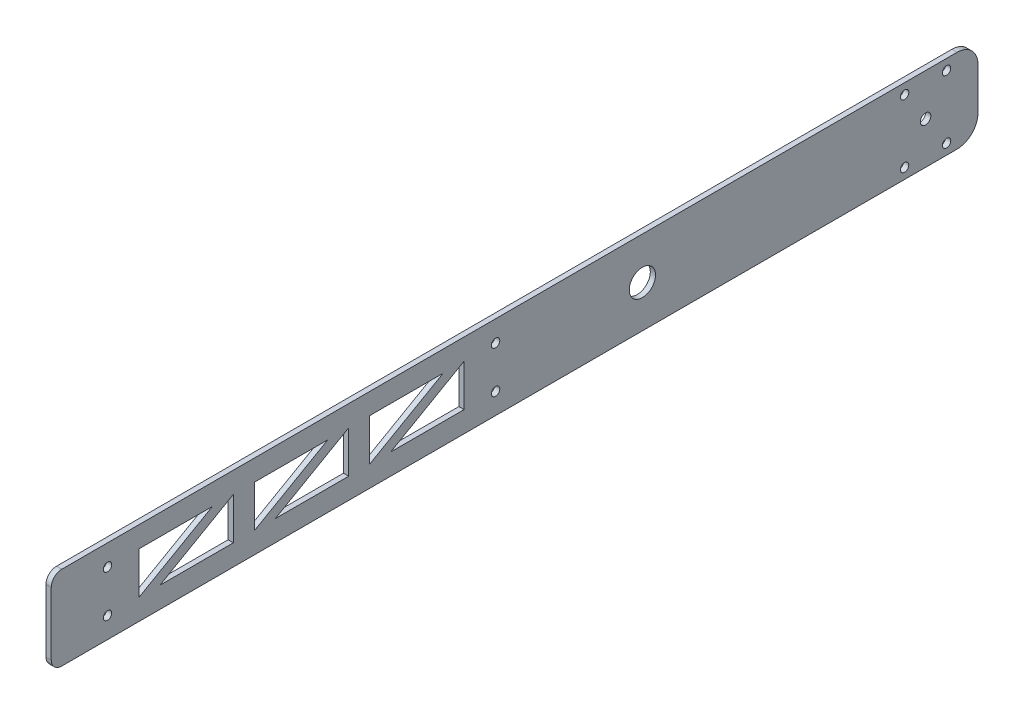
from build123d import *

# Parameters (mm, degrees)
SKETCH1_R           = 7.9629
SKETCH1_R_2         = 3.175
SKETCH1_R_3         = 2.5527
BOSS_EXTRUDE1_DEPTH = 3.175
SKETCH2_R           = 5.55625
CUT_EXTRUDE1_DEPTH  = 587.413131355
SKETCH3_W           = 200.88
SKETCH3_H           = 50.8
CUT_EXTRUDE2_DEPTH  = 587.413131355
FILLET1_R           = 6.35


with BuildPart() as part:
    # Sketch1 → Boss-Extrude1 (new body)
    with BuildSketch(Plane(origin=(0, 0, 0), x_dir=(0, 0, -1), z_dir=(1, 0, 0))):
        with BuildLine():
            Line((177.8, 38.1), (177.8, 12.7))
            ThreePointArc((177.8, 12.7), (174.080256121, 3.719743879), (165.1, 0))
            Line((165.1, 0), (-571.5, 0))
            ThreePointArc((-571.5, 0), (-580.480256121, 3.719743879), (-584.2, 12.7))
            Line((-584.2, 12.7), (-584.2, 38.1))
            ThreePointArc((-584.2, 38.1), (-580.480256121, 47.080256121), (-571.5, 50.8))
            Line((-571.5, 50.8), (165.1, 50.8))
            ThreePointArc((165.1, 50.8), (174.080256121, 47.080256121), (177.8, 38.1))
        make_face()
        with Locations((-25.4, 25.4)):
            Circle(SKETCH1_R, mode=Mode.SUBTRACT)
        with Locations((146.05, 25.4)):
            Circle(SKETCH1_R_2, mode=Mode.SUBTRACT)
        with Locations((-349.25, 38.1)):
            Circle(SKETCH1_R_3, mode=Mode.SUBTRACT)
        with Locations((-349.25, 12.7)):
            Circle(SKETCH1_R_3, mode=Mode.SUBTRACT)
        with Locations((-114.3, 38.1)):
            Circle(SKETCH1_R_3, mode=Mode.SUBTRACT)
        with Locations((-114.3, 12.7)):
            Circle(SKETCH1_R_3, mode=Mode.SUBTRACT)
        with Locations((133.35, 44.45)):
            Circle(SKETCH1_R_3, mode=Mode.SUBTRACT)
        with Locations((158.75, 44.45)):
            Circle(SKETCH1_R_3, mode=Mode.SUBTRACT)
        with Locations((158.75, 6.35)):
            Circle(SKETCH1_R_3, mode=Mode.SUBTRACT)
        with Locations((133.35, 6.35)):
            Circle(SKETCH1_R_3, mode=Mode.SUBTRACT)
        Polygon((-190.5, 38.1), (-146.05, 38.1), (-190.5, 12.7), align=None, mode=Mode.SUBTRACT)
        Polygon((-133.35, 38.1), (-133.35, 12.7), (-177.8, 12.7), align=None, mode=Mode.SUBTRACT)
        Polygon((-203.2, 12.7), (-203.2, 38.1), (-247.65, 12.7), align=None, mode=Mode.SUBTRACT)
        Polygon((-215.9, 38.1), (-260.35, 12.7), (-260.35, 38.1), align=None, mode=Mode.SUBTRACT)
        Polygon((-273.05, 38.1), (-273.05, 12.7), (-317.5, 12.7), align=None, mode=Mode.SUBTRACT)
        Polygon((-330.2, 12.7), (-330.2, 38.1), (-285.75, 38.1), align=None, mode=Mode.SUBTRACT)
    extrude(amount=BOSS_EXTRUDE1_DEPTH)

    # Sketch2 → Cut-Extrude1 (cut, through all)
    with BuildSketch(Plane(origin=(3.175, 0, 0), x_dir=(0, 0, -1), z_dir=(1, 0, 0))):
        with Locations((-558.8, 25.4)):
            Circle(SKETCH2_R)
    extrude(amount=-CUT_EXTRUDE1_DEPTH, mode=Mode.SUBTRACT)

    # Sketch3 → Cut-Extrude2 (cut, through all)
    with BuildSketch(Plane(origin=(3.175, 0, 0), x_dir=(0, 0, -1), z_dir=(1, 0, 0))):
        with Locations((-483.76, 25.4)):
            Rectangle(SKETCH3_W, SKETCH3_H)
    extrude(amount=-CUT_EXTRUDE2_DEPTH, mode=Mode.SUBTRACT)

    # Fillet1
    fillet1_edges = [part.edges().sort_by_distance(p)[0] for p in [
        (1.5875, 0, 383.32),
        (1.5875, 50.8, 383.32),
    ]]
    fillet(fillet1_edges, radius=FILLET1_R)


solid = part.part
